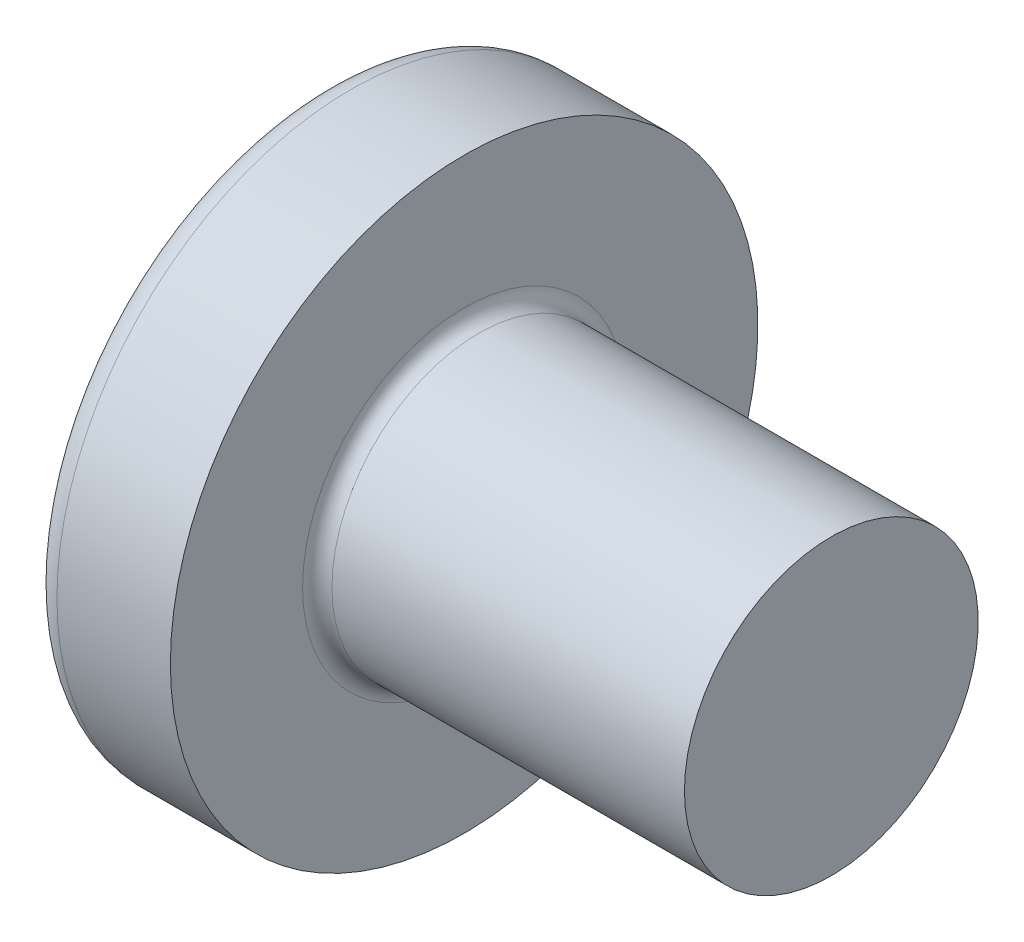
from build123d import *

# Parameters (mm, degrees)
RECPAT_COUNT = 2
RECPAT_ANGLE = 90


with BuildPart() as part:
    # Fillet1: read off the stored shape, not the designer's step
    # Fillet1 outline → Fillet1 (revolve)
    with BuildSketch(Plane.YX):
        with BuildLine():
            Line((2, 3.3), (2, 8.1))
            Line((2, 8.1), (0, 8.1))
            Line((0, 8.1), (0, 0))
            ThreePointArc((0, 0), (2.027933458, 0.324444488), (3.853420198, 1.265388956))
            ThreePointArc((3.853420198, 1.265388956), (3.961271902, 1.392873227), (4, 1.555305874))
            Line((4, 1.555305874), (4, 3.1))
            Line((4, 3.1), (2.2, 3.1))
            ThreePointArc((2.2, 3.1), (2.058578644, 3.158578644), (2, 3.3))
        make_face()
    revolve(axis=Axis((0, 0, 0), (1, 0, 0)))

    # Sketch3 → Recess section 0
    with BuildSketch(Plane(origin=(0, 0, 0), x_dir=(0, 0, -1), z_dir=(1, 0, 0))):
        with BuildLine():
            Line((0.515, -2.15), (-0.515, -2.15))
            Line((-0.515, -2.15), (-0.515, 2.15))
            Line((-0.515, 2.15), (0.515, 2.15))
            Line((0.515, 2.15), (0.515, -2.15))
        make_face()
    # Sketch4 → Recess section 1
    with BuildSketch(Plane(origin=(2.34, 0, 0), x_dir=(0, 0, -1), z_dir=(1, 0, 0))):
        with BuildLine():
            Line((0.515, -0.983319232), (-0.515, -0.983319232))
            Line((-0.515, -0.983319232), (-0.515, 0.983319232))
            Line((-0.515, 0.983319232), (0.515, 0.983319232))
            Line((0.515, 0.983319232), (0.515, -0.983319232))
        make_face()
    recess = loft(mode=Mode.SUBTRACT)

    # RecPat: Recess ×2 about axis
    recpat_axis = Axis((0, 0, 0), (1, 0, 0))
    for i in range(1, RECPAT_COUNT):
        add(recess.rotate(recpat_axis, i * RECPAT_ANGLE / (RECPAT_COUNT - 1)), mode=Mode.SUBTRACT)

    # RecCorSke → RecessCore (revolve, cut)
    with BuildSketch(Plane.XY, mode=Mode.PRIVATE) as recesscore_sk:
        Polygon((0, 0), (0, 1.01462874), (2.34, 0.851), (2.616506661, 0), align=None)
    revolve(recesscore_sk.sketch.rotate(Axis((-3.175, 0, 0), (1, 0, 0)), 90), axis=Axis((-3.175, 0, 0), (1, 0, 0)), mode=Mode.SUBTRACT)


solid = part.part
